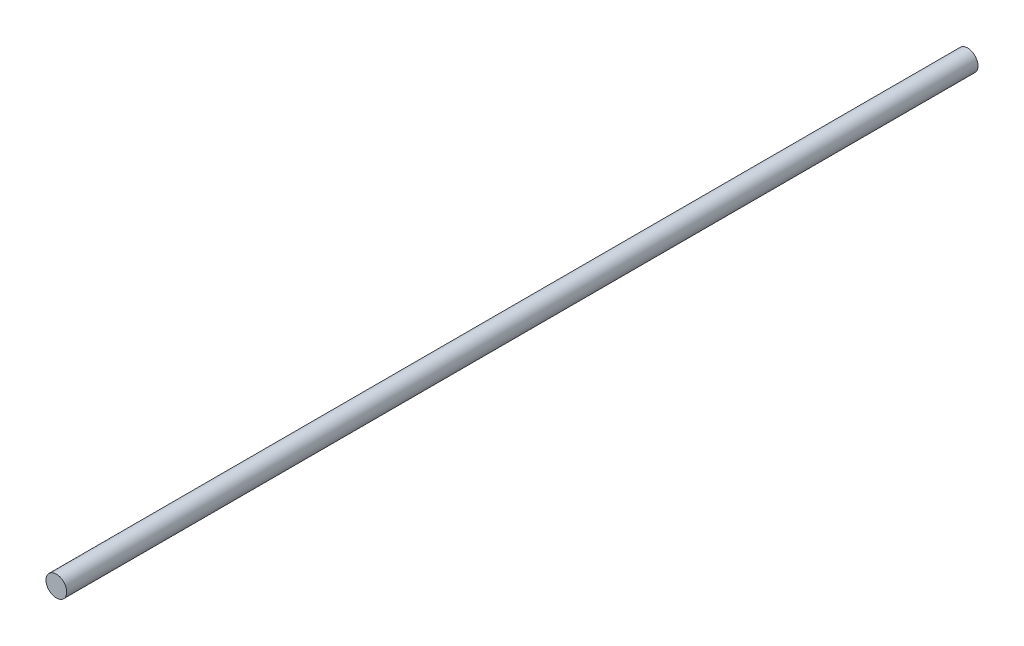
from build123d import *

# Parameters (mm, degrees)
SKETCH1_R           = 2.5
BOSS_EXTRUDE1_DEPTH = 220


with BuildPart() as part:
    # Sketch1 → Boss-Extrude1 (new body)
    with BuildSketch(Plane.XY):
        Circle(SKETCH1_R)
    extrude(amount=BOSS_EXTRUDE1_DEPTH)


solid = part.part
